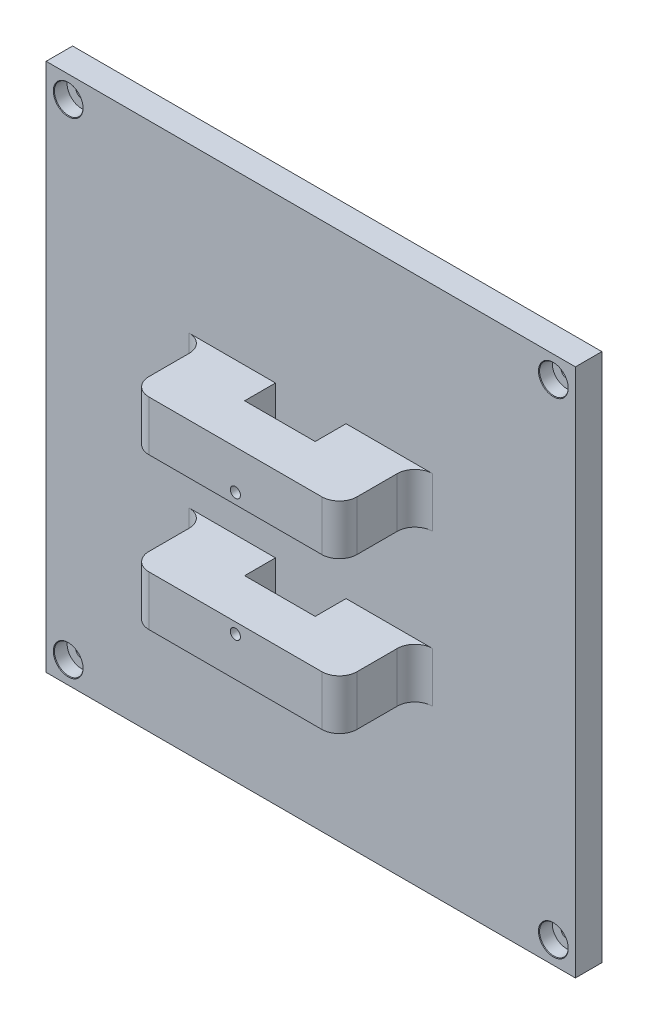
from build123d import *

# Parameters (mm, degrees)
SKETCH1_W           = 120
SKETCH1_H           = 120
BOSS_EXTRUDE1_DEPTH = 6
SKETCH3_W           = 47.19594468
SKETCH3_H           = 11.33645236
BOSS_EXTRUDE2_DEPTH = 17.1
SKETCH4_W           = 16
SKETCH4_H           = 7
CUT_EXTRUDE3_DEPTH  = 105.85937173
SKETCH6_R           = 1.15
CUT_EXTRUDE4_DEPTH  = 8
FILLET1_R           = 4


with BuildPart() as part:
    # Sketch1 → Boss-Extrude1 (new body)
    with BuildSketch(Plane(origin=(0, 0, 0), x_dir=(0, 1, 0), z_dir=(0, 0, 1))):
        Rectangle(SKETCH1_W, SKETCH1_H)
    extrude(amount=BOSS_EXTRUDE1_DEPTH)

    # Sketch7 → CBORE for M3 SBHCS1 (revolve, cut)
    with BuildSketch(Plane(origin=(-55, 55, 6), x_dir=(0, -1, 0), z_dir=(1, 0, 0))):
        Polygon((0, 0), (0, 6), (1.25, 6), (1.25, 3), (3.25, 3), (3.25, 0.125), (3.375, 0), align=None)
    cbore_for_m3_sbhcs1 = revolve(axis=Axis((-55, 55, 12.35), (0, 0, -1)), mode=Mode.SUBTRACT)

    # Mirror2: CBORE for M3 SBHCS1 across plane
    add(cbore_for_m3_sbhcs1.mirror(Plane(origin=(0, 0, 0), x_dir=(0, 0, 1), z_dir=(1, 0, 0))), mode=Mode.SUBTRACT)

    # Mirror2 at the second plane: CBORE for M3 SBHCS1 across plane
    add(cbore_for_m3_sbhcs1.mirror(Plane.ZX), mode=Mode.SUBTRACT)

    # Mirror2 at the second plane copy 1 sketc → Mirror2 at the second plane copy 1 (revolve, cut)
    with BuildSketch(Plane(origin=(55, -55, 6), x_dir=(0, 1, 0), z_dir=(-1, 0, 0))):
        Polygon((0, 0), (0, 6), (1.25, 6), (1.25, 3), (3.25, 3), (3.25, 0.125), (3.375, 0), align=None)
    revolve(axis=Axis((55, -55, 12.35), (0, 0, -1)), mode=Mode.SUBTRACT)

    # Sketch3 → Boss-Extrude2 (add)
    with BuildSketch(Plane.XY.offset(6)):
        with Locations((0, -17.16822618)):
            Rectangle(SKETCH3_W, SKETCH3_H)
        with Locations((0, 17.16822618)):
            Rectangle(SKETCH3_W, SKETCH3_H)
    extrude(amount=BOSS_EXTRUDE2_DEPTH)

    # Sketch4 → Cut-Extrude3 (cut, through all)
    with BuildSketch(Plane.XZ.offset(22.83645236)):
        with Locations((0, 9.5)):
            Rectangle(SKETCH4_W, SKETCH4_H)
    extrude(amount=-CUT_EXTRUDE3_DEPTH, mode=Mode.SUBTRACT)

    # Sketch6 → Cut-Extrude4 (cut)
    with BuildSketch(Plane.XY.offset(23.1)):
        with Locations((0, 13.9)):
            Circle(SKETCH6_R)
        with Locations((0, -13.9)):
            Circle(SKETCH6_R)
    extrude(amount=-CUT_EXTRUDE4_DEPTH, mode=Mode.SUBTRACT)

    # Fillet1
    fillet1_edges = [part.edges().sort_by_distance(p)[0] for p in [
        (-23.59797234, -17.16822618, 6),
        (-23.59797234, 17.16822618, 6),
        (23.59797234, 17.16822618, 6),
        (23.59797234, -17.16822618, 6),
        (-23.59797234, 17.16822618, 23.1),
        (23.59797234, 17.16822618, 23.1),
        (-23.59797234, -17.16822618, 23.1),
        (23.59797234, -17.16822618, 23.1),
    ]]
    fillet(fillet1_edges, radius=FILLET1_R)


solid = part.part
